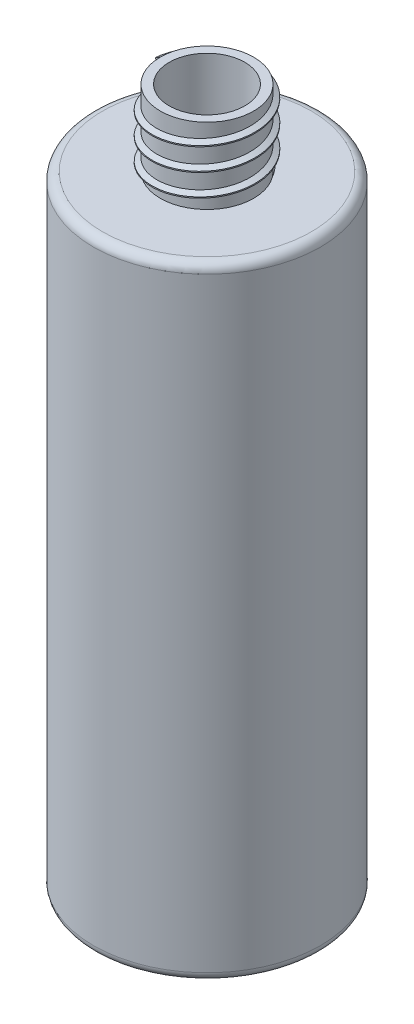
from build123d import *

# Parameters (mm, degrees)
BO_ALTMA1_T = -2
RADYUS1_R   = 2
DI_1_PITCH  = 5


with BuildPart() as part:
    # Çizim1 → Döndür1 (revolve)
    with BuildSketch(Plane.XY, mode=Mode.PRIVATE) as d_nd_r1_sk:
        Polygon((0, 0), (-25.5, 0), (-25.5, 140), (-10.5, 140), (-10.5, 157), (0, 157), align=None)
    revolve(d_nd_r1_sk.sketch.rotate(Axis((0, 0, 0), (0, 1, 0)), 270), axis=Axis((0, 0, 0), (0, 1, 0)))

    # İç Boşaltma1
    bo_altma1_openings = [part.faces().sort_by_distance(p)[0] for p in [
        (0, 157, 0),
    ]]
    offset(amount=BO_ALTMA1_T, openings=bo_altma1_openings, kind=Kind.INTERSECTION)

    # Radyus1
    radyus1_edges = [part.edges().sort_by_distance(p)[0] for p in [
        (0, 140, 25.5),
        (0, 0, 25.5),
    ]]
    fillet(radyus1_edges, radius=RADYUS1_R)

    # Diş1: the profile of Diş Profili1 profile screwed along a right-hand helix of 3.4 turns, 12 arcs to a turn; built about Z, then put on its axis
    di_1_z = Axis((0, 0, 0), (0, 0, 1))
    di_1_corners = [(10.4997, 0, -0.000173205), (11.58253175, 0, 0.624999997), (11.58253175, 0, 0.874999997), (10.4997, 0, 1.5001732)]
    with BuildLine(mode=Mode.PRIVATE) as di_1_profile:
        Line(di_1_corners[0], di_1_corners[1])
        Line(di_1_corners[1], di_1_corners[2])
        Line(di_1_corners[2], di_1_corners[3])
        Line(di_1_corners[3], di_1_corners[0])
    di_1_cap = Face(di_1_profile.wire())
    di_1_turn_angles = [0, 15, 30, 45, 60, 75, 90, 105, 120, 135, 150, 165, 180, 195, 210, 225, 240, 255, 270, 285, 300, 315, 330, 345, 360]
    di_1_turn_weights = [1, 0.9659258262890683, 1, 0.9659258262890683, 1, 0.9659258262890683, 1, 0.9659258262890683, 1, 0.9659258262890683, 1, 0.9659258262890683, 1, 0.9659258262890683, 1, 0.9659258262890683, 1, 0.9659258262890683, 1, 0.9659258262890683, 1, 0.9659258262890683, 1, 0.9659258262890683, 1]
    di_1_turn_rails = [Edge.make_bspline([Vector(p[0], p[1], 0).rotate(di_1_z, di_1_turn_angles[k]) / di_1_turn_weights[k] + Vector(0, 0, p[2] + DI_1_PITCH * di_1_turn_angles[k] / 360) for k in range(25)], [0, 0, 0, 1, 1, 2, 2, 3, 3, 4, 4, 5, 5, 6, 6, 7, 7, 8, 8, 9, 9, 10, 10, 11, 11, 12, 12, 12], 2, di_1_turn_weights) for p in di_1_corners]
    di_1_turn_sides = [Face.make_surface_from_curves(di_1_turn_rails[p[0]], di_1_turn_rails[p[1]]) for p in [(0, 1), (1, 2), (2, 3), (3, 0)]]
    di_1_last_angles = [1080, 1095, 1110, 1125, 1140, 1155, 1170, 1185, 1200, 1212, 1224]
    di_1_last_weights = [1, 0.9659258262890683, 1, 0.9659258262890683, 1, 0.9659258262890683, 1, 0.9659258262890683, 1, 0.9781476007338036, 1]
    di_1_last_rails = [Edge.make_bspline([Vector(p[0], p[1], 0).rotate(di_1_z, di_1_last_angles[k]) / di_1_last_weights[k] + Vector(0, 0, p[2] + DI_1_PITCH * di_1_last_angles[k] / 360) for k in range(11)], [0, 0, 0, 1, 1, 2, 2, 3, 3, 4, 4, 5, 5, 5], 2, di_1_last_weights) for p in di_1_corners]
    di_1_last_sides = [Face.make_surface_from_curves(di_1_last_rails[p[0]], di_1_last_rails[p[1]]) for p in [(0, 1), (1, 2), (2, 3), (3, 0)]]
    di_1 = Plane(origin=(0, 157, 0), x_dir=(-1, 0, 0), z_dir=(0, -1, 0)) * Solid(Shell([*[p.moved(Location((0, 0, DI_1_PITCH * i))) for i in range(3) for p in di_1_turn_sides], *di_1_last_sides, di_1_cap, di_1_cap.rotate(di_1_z, 1224).moved(Location((0, 0, DI_1_PITCH * 1224 / 360)))]))
    add(di_1)


solid = part.part
